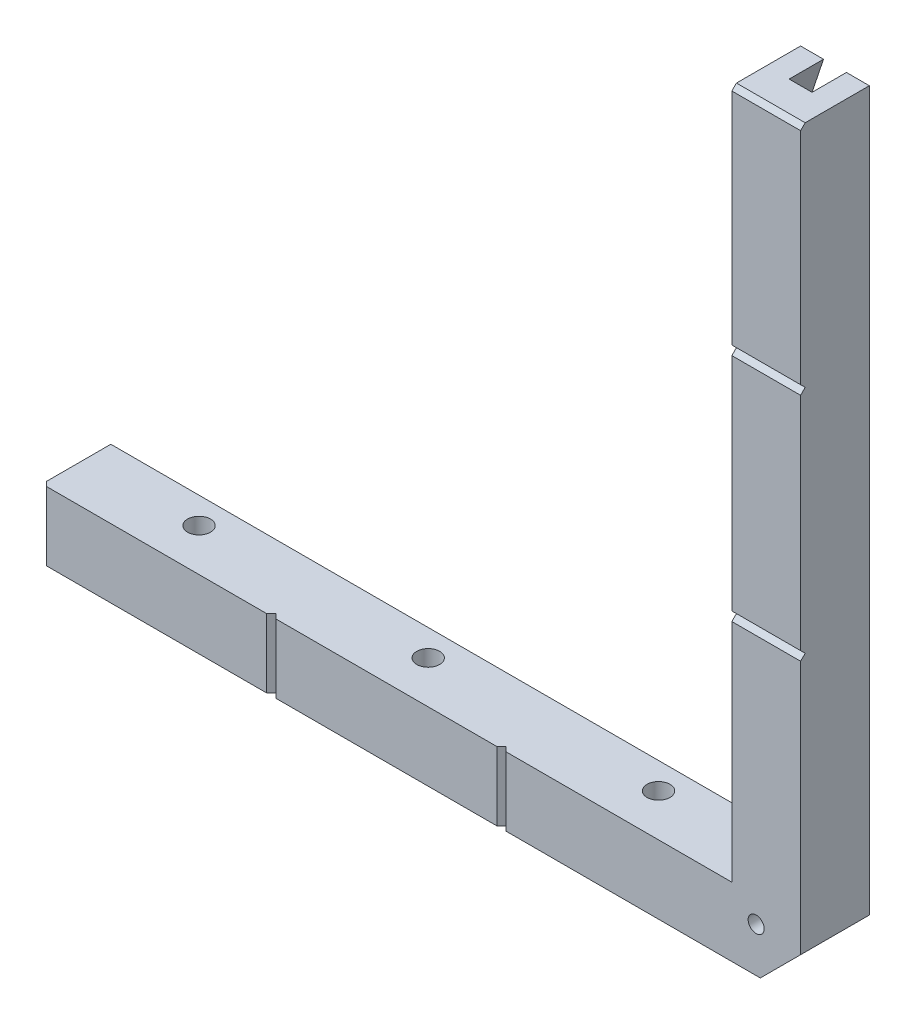
from build123d import *

# Parameters (mm, degrees)
BODY_DEPTH                 = 15
SKETCH3_W                  = 2
SKETCH3_H                  = 15
SKETCH3_W_2                = 15
SKETCH3_H_2                = 2
FIELD_CUT_DEPTH            = 2
FIELD_CHAMFER_SIZE         = 2
CLICK_CHAMFER_1_DEPTH      = 225.199687779
CLICK_CHAMFER_1_DEPTH_BACK = 225.199687779
CLICK_CHAMFER_2_DEPTH      = 225.199687779
CLICK_CHAMFER_2_DEPTH_BACK = 225.199687779
SKETCH7_R                  = 2.5
LED_HOLE_2_DEPTH           = 8
SKETCH8_R                  = 2.5
LED_HOLE_1_DEPTH           = 8
CORNER_CHAMFER_DEPTH       = 214.367054627
CORNER_CHAMFER_DEPTH_BACK  = 214.367054627
CLICK_HOLE_DEPTH           = 7.5
SKETCH12_W                 = 1
SKETCH12_H                 = 15
LIGHT_GUIDE_1_DEPTH        = 13
SKETCH13_W                 = 15
SKETCH13_H                 = 1
LIGHT_GUIDE_2_DEPTH        = 13
MOUNTING_HOLE_DEPTH        = 214.367054627
MOUNTING_HOLE_DEPTH_BACK   = 214.367054627
SKETCH14_R                 = 1.75
SKETCH15_W                 = 1
SKETCH15_H                 = 19
SKETCH15_W_2               = 19
SKETCH15_H_2               = 1
CUT_EXTRUDE1_DEPTH         = 13.25


with BuildPart() as part:
    # Sketch1 → Body (new body)
    with BuildSketch(Plane.XY):
        Polygon((0, 0), (0, 150.5), (15, 150.5), (15, -15), (-150.5, -15), (-150.5, 0), align=None)
    extrude(amount=BODY_DEPTH)

    # Sketch3 → Field Cut (cut)
    with BuildSketch(Plane.XY.offset(15)):
        with Locations((-50.25, -7.5)):
            Rectangle(SKETCH3_W, SKETCH3_H)
        with Locations((-100.5, -7.5)):
            Rectangle(SKETCH3_W, SKETCH3_H)
        with Locations((7.5, 50.25)):
            Rectangle(SKETCH3_W_2, SKETCH3_H_2)
        with Locations((7.5, 100.5)):
            Rectangle(SKETCH3_W_2, SKETCH3_H_2)
    extrude(amount=-FIELD_CUT_DEPTH, mode=Mode.SUBTRACT)

    # Field Chamfer
    # the kernel refuses this chamfer: 2 mm, written as the material it adds along each edge
    with BuildSketch(Plane(origin=(-101.5, 0, 13), x_dir=(0.9996219169112968, 0, -0.027495876610586414), z_dir=(0, -1, 0))) as field_chamfer_piece_1_section:
        Polygon((FIELD_CHAMFER_SIZE * 0.999621916911, FIELD_CHAMFER_SIZE * 0.0274958766106), (-FIELD_CHAMFER_SIZE * 0.0274958766106, FIELD_CHAMFER_SIZE * 0.999621916911), (0, 0), align=None)
    field_chamfer_piece_1 = extrude(amount=15, mode=Mode.PRIVATE)
    field_chamfer_piece_1 = split(field_chamfer_piece_1, bisect_by=Plane(origin=(-100.839191691, -7.5, 15), z_dir=(0, 0, -1)), keep=Keep.TOP, mode=Mode.PRIVATE)
    add(field_chamfer_piece_1)
    with BuildSketch(Plane(origin=(-99.5, -15, 13), x_dir=(0.02749587661058907, 0, 0.9996219169112965), z_dir=(0, 1, 0))) as field_chamfer_piece_2_section:
        Polygon((FIELD_CHAMFER_SIZE * 0.999621916911, -FIELD_CHAMFER_SIZE * 0.0274958766106), (-FIELD_CHAMFER_SIZE * 0.0274958766106, -FIELD_CHAMFER_SIZE * 0.999621916911), (0, 0), align=None)
    field_chamfer_piece_2 = extrude(amount=15, mode=Mode.PRIVATE)
    field_chamfer_piece_2 = split(field_chamfer_piece_2, bisect_by=Plane(origin=(-100.160808309, -7.5, 15), z_dir=(0, 0, -1)), keep=Keep.TOP, mode=Mode.PRIVATE)
    add(field_chamfer_piece_2)
    with BuildSketch(Plane(origin=(-51.25, 0, 13), x_dir=(0.9996219169112968, 0, -0.02749587661058651), z_dir=(0, -1, 0))) as field_chamfer_piece_3_section:
        Polygon((FIELD_CHAMFER_SIZE * 0.999621916911, FIELD_CHAMFER_SIZE * 0.0274958766106), (-FIELD_CHAMFER_SIZE * 0.0274958766106, FIELD_CHAMFER_SIZE * 0.999621916911), (0, 0), align=None)
    field_chamfer_piece_3 = extrude(amount=15, mode=Mode.PRIVATE)
    field_chamfer_piece_3 = split(field_chamfer_piece_3, bisect_by=Plane(origin=(-50.589191691, -7.5, 15), z_dir=(0, 0, -1)), keep=Keep.TOP, mode=Mode.PRIVATE)
    add(field_chamfer_piece_3)
    with BuildSketch(Plane(origin=(-49.25, -15, 13), x_dir=(0.027495876610585623, 0, 0.9996219169112968), z_dir=(0, 1, 0))) as field_chamfer_piece_4_section:
        Polygon((FIELD_CHAMFER_SIZE * 0.999621916911, -FIELD_CHAMFER_SIZE * 0.0274958766106), (-FIELD_CHAMFER_SIZE * 0.0274958766106, -FIELD_CHAMFER_SIZE * 0.999621916911), (0, 0), align=None)
    field_chamfer_piece_4 = extrude(amount=15, mode=Mode.PRIVATE)
    field_chamfer_piece_4 = split(field_chamfer_piece_4, bisect_by=Plane(origin=(-49.910808309, -7.5, 15), z_dir=(0, 0, -1)), keep=Keep.TOP, mode=Mode.PRIVATE)
    add(field_chamfer_piece_4)
    with BuildSketch(Plane(origin=(15, 49.25, 13), x_dir=(0, 0.9996219169112968, -0.02749587661058651), z_dir=(-1, 0, 0))) as field_chamfer_piece_5_section:
        Polygon((FIELD_CHAMFER_SIZE * 0.999621916911, -FIELD_CHAMFER_SIZE * 0.0274958766106), (-FIELD_CHAMFER_SIZE * 0.0274958766106, -FIELD_CHAMFER_SIZE * 0.999621916911), (0, 0), align=None)
    field_chamfer_piece_5 = extrude(amount=15, mode=Mode.PRIVATE)
    field_chamfer_piece_5 = split(field_chamfer_piece_5, bisect_by=Plane(origin=(7.5, 49.910808309, 15), z_dir=(0, 0, -1)), keep=Keep.TOP, mode=Mode.PRIVATE)
    add(field_chamfer_piece_5)
    with BuildSketch(Plane(origin=(0, 51.25, 13), x_dir=(0, 0.027495876610585623, 0.9996219169112968), z_dir=(1, 0, 0))) as field_chamfer_piece_6_section:
        Polygon((FIELD_CHAMFER_SIZE * 0.999621916911, FIELD_CHAMFER_SIZE * 0.0274958766106), (-FIELD_CHAMFER_SIZE * 0.0274958766106, FIELD_CHAMFER_SIZE * 0.999621916911), (0, 0), align=None)
    field_chamfer_piece_6 = extrude(amount=15, mode=Mode.PRIVATE)
    field_chamfer_piece_6 = split(field_chamfer_piece_6, bisect_by=Plane(origin=(7.5, 50.589191691, 15), z_dir=(0, 0, -1)), keep=Keep.TOP, mode=Mode.PRIVATE)
    add(field_chamfer_piece_6)
    with BuildSketch(Plane(origin=(0, 101.5, 13), x_dir=(0, 0.02749587661058907, 0.9996219169112965), z_dir=(1, 0, 0))) as field_chamfer_piece_7_section:
        Polygon((FIELD_CHAMFER_SIZE * 0.999621916911, FIELD_CHAMFER_SIZE * 0.0274958766106), (-FIELD_CHAMFER_SIZE * 0.0274958766106, FIELD_CHAMFER_SIZE * 0.999621916911), (0, 0), align=None)
    field_chamfer_piece_7 = extrude(amount=15, mode=Mode.PRIVATE)
    field_chamfer_piece_7 = split(field_chamfer_piece_7, bisect_by=Plane(origin=(7.5, 100.839191691, 15), z_dir=(0, 0, -1)), keep=Keep.TOP, mode=Mode.PRIVATE)
    add(field_chamfer_piece_7)
    with BuildSketch(Plane(origin=(15, 99.5, 13), x_dir=(0, 0.9996219169112968, -0.027495876610586414), z_dir=(-1, 0, 0))) as field_chamfer_piece_8_section:
        Polygon((FIELD_CHAMFER_SIZE * 0.999621916911, -FIELD_CHAMFER_SIZE * 0.0274958766106), (-FIELD_CHAMFER_SIZE * 0.0274958766106, -FIELD_CHAMFER_SIZE * 0.999621916911), (0, 0), align=None)
    field_chamfer_piece_8 = extrude(amount=15, mode=Mode.PRIVATE)
    field_chamfer_piece_8 = split(field_chamfer_piece_8, bisect_by=Plane(origin=(7.5, 100.160808309, 15), z_dir=(0, 0, -1)), keep=Keep.TOP, mode=Mode.PRIVATE)
    add(field_chamfer_piece_8)

    # Sketch4 → Click Chamfer 1 (cut, two sides: drawn at the far end of the back side and taken through both)
    with BuildSketch(Plane.XZ.offset(15).offset(-CLICK_CHAMFER_1_DEPTH_BACK)):
        Polygon((-150.5, 15), (-150.5, 14), (-149.5, 15), align=None)
    extrude(amount=CLICK_CHAMFER_1_DEPTH + CLICK_CHAMFER_1_DEPTH_BACK, mode=Mode.SUBTRACT)

    # Sketch5 → Click Chamfer 2 (cut, two sides: drawn at the far end of the back side and taken through both)
    with BuildSketch(Plane(origin=(15, 0, 0), x_dir=(0, 0, -1), z_dir=(1, 0, 0)).offset(-CLICK_CHAMFER_2_DEPTH_BACK)):
        Polygon((-15, 150.5), (-15, 149.5), (-14, 150.5), align=None)
    extrude(amount=CLICK_CHAMFER_2_DEPTH + CLICK_CHAMFER_2_DEPTH_BACK, mode=Mode.SUBTRACT)

    # Sketch7 → LED Hole 2 (cut)
    with BuildSketch(Plane.ZY):
        with Locations((5.75, 75.25)):
            Circle(SKETCH7_R)
        with Locations((5.75, 125.5)):
            Circle(SKETCH7_R)
        with Locations((5.75, 25.25)):
            Circle(SKETCH7_R)
    extrude(amount=-LED_HOLE_2_DEPTH, mode=Mode.SUBTRACT)

    # Sketch8 → LED Hole 1 (cut)
    with BuildSketch(Plane(origin=(0, 0, 0), x_dir=(1, 0, 0), z_dir=(0, 1, 0))):
        with Locations(Location((-125.5, -5.75, 0), (0, 0, 270))):
            Circle(SKETCH8_R)
        with Locations(Location((-75.5, -5.75, 0), (0, 0, 270))):
            Circle(SKETCH8_R)
        with Locations(Location((-25.25, -5.75, 0), (0, 0, 270))):
            Circle(SKETCH8_R)
    extrude(amount=-LED_HOLE_1_DEPTH, mode=Mode.SUBTRACT)

    # Sketch9 → Corner Chamfer (cut, two sides: drawn at the far end of the back side and taken through both)
    with BuildSketch(Plane.XY.offset(15).offset(-CORNER_CHAMFER_DEPTH_BACK)):
        Polygon((15, -6.213203436), (6.213203436, -15), (15, -15), align=None)
    extrude(amount=CORNER_CHAMFER_DEPTH + CORNER_CHAMFER_DEPTH_BACK, mode=Mode.SUBTRACT)

    # Sketch10 → Click Hole (cut)
    with BuildSketch(Plane(origin=(0, 0, 0), x_dir=(-1, 0, 0), z_dir=(0, 0, -1))):
        Polygon((150.5, -5), (143, -2.5), (143, -12.5), (150.5, -10), align=None)
        Polygon((-7.5, 150.5), (-10, 150.5), (-12.5, 143), (-7.5, 143), (-2.5, 143), (-5, 150.5), align=None)
    extrude(amount=-CLICK_HOLE_DEPTH, mode=Mode.SUBTRACT)

    # Sketch12 → Light Guide 1 (cut)
    with BuildSketch(Plane(origin=(0, -1, 0), x_dir=(1, 0, 0), z_dir=(0, 1, 0))):
        with Locations((-35.25, -5.75)):
            Rectangle(SKETCH12_W, SKETCH12_H)
        with Locations((-15.25, -5.75)):
            Rectangle(SKETCH12_W, SKETCH12_H)
        with Locations((-65.5, -5.75)):
            Rectangle(SKETCH12_W, SKETCH12_H)
        with Locations((-85.5, -5.75)):
            Rectangle(SKETCH12_W, SKETCH12_H)
        with Locations((-115.5, -5.75)):
            Rectangle(SKETCH12_W, SKETCH12_H)
        with Locations((-135.5, -5.75)):
            Rectangle(SKETCH12_W, SKETCH12_H)
    extrude(amount=-LIGHT_GUIDE_1_DEPTH, mode=Mode.SUBTRACT)

    # Sketch13 → Light Guide 2 (cut)
    with BuildSketch(Plane.ZY.offset(-1)):
        with Locations((5.75, 35.25)):
            Rectangle(SKETCH13_W, SKETCH13_H)
        with Locations((5.75, 15.25)):
            Rectangle(SKETCH13_W, SKETCH13_H)
        with Locations((5.75, 65.25)):
            Rectangle(SKETCH13_W, SKETCH13_H)
        with Locations((5.75, 85.25)):
            Rectangle(SKETCH13_W, SKETCH13_H)
        with Locations((5.75, 115.5)):
            Rectangle(SKETCH13_W, SKETCH13_H)
        with Locations((5.75, 135.5)):
            Rectangle(SKETCH13_W, SKETCH13_H)
    extrude(amount=-LIGHT_GUIDE_2_DEPTH, mode=Mode.SUBTRACT)

    # Sketch14 → Mounting Hole (cut, two sides: drawn at the far end of the back side and taken through both)
    with BuildSketch(Plane.XY.offset(15).offset(-MOUNTING_HOLE_DEPTH_BACK)):
        with Locations((5.303300859, -5.303300859)):
            Circle(SKETCH14_R)
    extrude(amount=MOUNTING_HOLE_DEPTH + MOUNTING_HOLE_DEPTH_BACK, mode=Mode.SUBTRACT)

    # Sketch15 → Cut-Extrude1 (cut)
    with BuildSketch(Plane(origin=(0, 0, 0), x_dir=(-1, 0, 0), z_dir=(0, 0, -1))):
        with Locations((-13.5, 125.5)):
            Rectangle(SKETCH15_W, SKETCH15_H)
        with Locations((-13.5, 75.25)):
            Rectangle(SKETCH15_W, SKETCH15_H)
        with Locations((-13.5, 25.25)):
            Rectangle(SKETCH15_W, SKETCH15_H)
        with Locations((25.25, -13.5)):
            Rectangle(SKETCH15_W_2, SKETCH15_H_2)
        with Locations((75.5, -13.5)):
            Rectangle(SKETCH15_W_2, SKETCH15_H_2)
        with Locations((125.5, -13.5)):
            Rectangle(SKETCH15_W_2, SKETCH15_H_2)
    extrude(amount=-CUT_EXTRUDE1_DEPTH, mode=Mode.SUBTRACT)


solid = part.part
